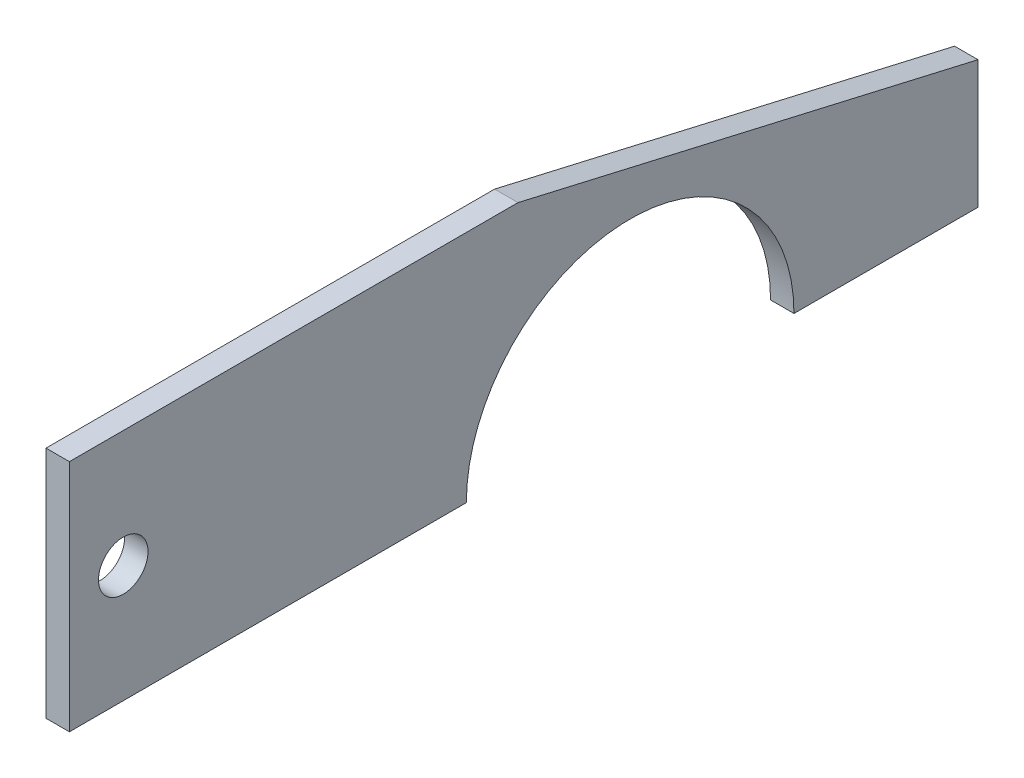
from build123d import *

# Parameters (mm, degrees)
BOSS_EXTRUDE1_DEPTH = 3
SKETCH2_R           = 3.175
CUT_EXTRUDE1_DEPTH  = 121.313656499


with BuildPart() as part:
    # Sketch1 → Boss-Extrude1 (new body)
    with BuildSketch(Plane(origin=(0, 0, 0), x_dir=(0, 0, -1), z_dir=(1, 0, 0))):
        with BuildLine():
            Line((0, 0), (57.50407585, 0))
            Line((57.50407585, 0), (116.474786715, -13.615081165))
            Line((116.474786715, -13.615081165), (116.474786715, -30))
            Line((116.474786715, -30), (92.883246032, -30))
            ThreePointArc((92.883246032, -30), (71.883246032, -9), (50.883246032, -30))
            Line((50.883246032, -30), (0, -30))
            Line((0, -30), (0, 0))
        make_face()
    extrude(amount=BOSS_EXTRUDE1_DEPTH)

    # Sketch2 → Cut-Extrude1 (cut, through all)
    with BuildSketch(Plane(origin=(3, 0, 0), x_dir=(0, 0, -1), z_dir=(1, 0, 0))):
        with Locations((6.900903962, -15)):
            Circle(SKETCH2_R)
    extrude(amount=-CUT_EXTRUDE1_DEPTH, mode=Mode.SUBTRACT)


solid = part.part
